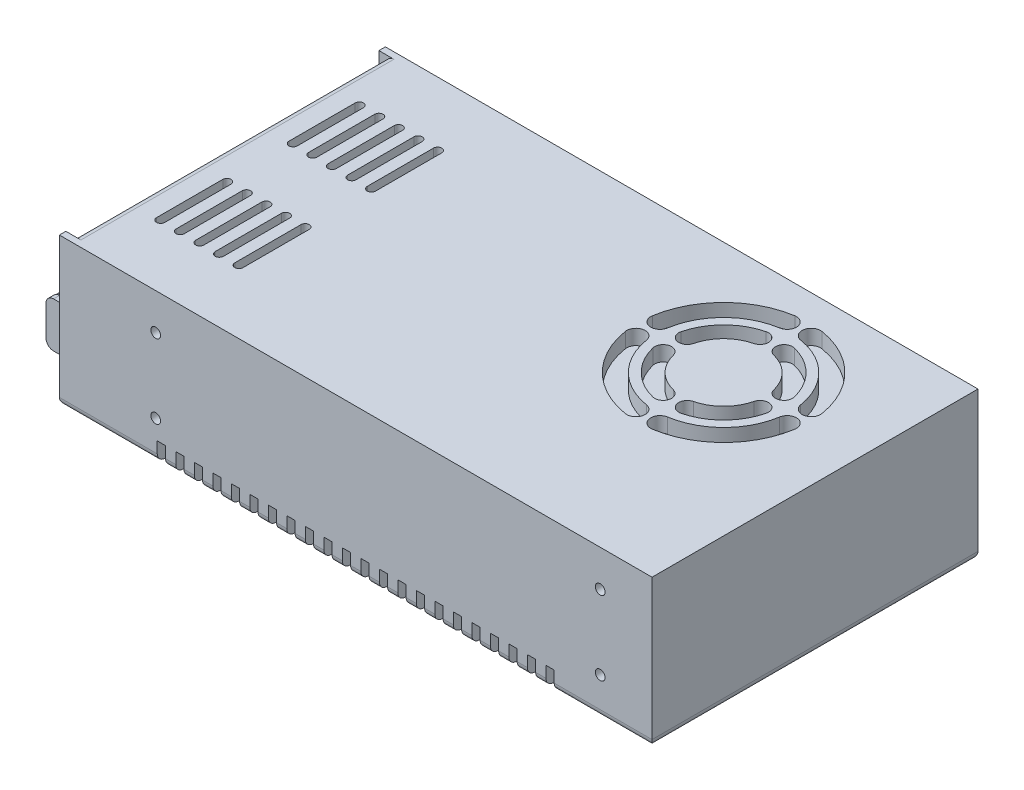
from build123d import *

# Parameters (mm, degrees)
SKETCH1_W                 = 200
SKETCH1_H                 = 110
BOSS_EXTRUDE1_DEPTH       = 50
SKETCH2_W                 = 2.54
SKETCH2_H                 = 105.6312
CUT_EXTRUDE1_DEPTH        = 41.91
SKETCH3_W                 = 89.408
SKETCH3_H                 = 15.24
BOSS_EXTRUDE2_DEPTH       = 12.7
CUT_EXTRUDE3_DEPTH        = 25.4
SKETCH5_W                 = 6.35
SKETCH5_H                 = 8.89
BOSS_EXTRUDE3_DEPTH       = 8.89
SKETCH6_W                 = 8.128
SKETCH6_H                 = 8.128
CUT_EXTRUDE4_DEPTH        = 126.74779117
SKETCH8_R                 = 1.905
BOSS_EXTRUDE4_DEPTH       = 2.54
SKETCH9_R                 = 3.81
BOSS_EXTRUDE5_DEPTH       = 3.81
FILLET1_R                 = 1.27
CUT_EXTRUDE6_DEPTH        = 5.08
CUT_EXTRUDE7_DEPTH        = 5.08
FILLET2_R                 = 2.54
CUT_EXTRUDE8_DEPTH        = 6.35
SKETCH13_W                = 89.408
SKETCH13_H                = 15.24
BOSS_EXTRUDE6_DEPTH       = 0.254
FILLET3_R                 = 2.54
SKETCH14_W                = 1.831730769
SKETCH14_H                = 0.488461538
SKETCH14_W_2              = 3.175
SKETCH14_H_2              = 0.427403847
SKETCH14_W_3              = 0.314102564
SKETCH14_H_3              = 4.532051282
CUT_EXTRUDE9_DEPTH        = 0.254
M4X0_7_TAPPED_HOLE1_D     = 3.3
M4X0_7_TAPPED_HOLE1_DEPTH = 9.906
M4X0_7_TAPPED_HOLE1_TIP   = 0.991420021
M4X0_7_TAPPED_HOLE2_D     = 3.3
M4X0_7_TAPPED_HOLE2_DEPTH = 9.906
M4X0_7_TAPPED_HOLE2_TIP   = 0.991420021
M4X0_7_TAPPED_HOLE3_D     = 3.3
M4X0_7_TAPPED_HOLE3_DEPTH = 9.906
M4X0_7_TAPPED_HOLE3_TIP   = 0.991420021


with BuildPart() as part:
    # Sketch1 → Boss-Extrude1 (new body)
    with BuildSketch(Plane(origin=(0, 0, 0), x_dir=(1, 0, 0), z_dir=(0, 1, 0))):
        Rectangle(SKETCH1_W, SKETCH1_H)
    extrude(amount=BOSS_EXTRUDE1_DEPTH)

    # Sketch2 → Cut-Extrude1 (cut)
    with BuildSketch(Plane(origin=(0, 50, 0), x_dir=(1, 0, 0), z_dir=(0, 1, 0))):
        with Locations((-98.73, 0)):
            Rectangle(SKETCH2_W, SKETCH2_H)
    extrude(amount=-CUT_EXTRUDE1_DEPTH, mode=Mode.SUBTRACT)

    # Sketch3 → Boss-Extrude2 (add)
    with BuildSketch(Plane.ZY.offset(97.46)):
        with Locations((4.4032, 16.8402)):
            Rectangle(SKETCH3_W, SKETCH3_H)
    extrude(amount=BOSS_EXTRUDE2_DEPTH)

    # Sketch4 → Cut-Extrude3 (cut)
    with BuildSketch(Plane.ZY.offset(97.46)):
        Polygon((-40.3008, 9.2202), (-52.8156, 9.2202), (-52.8156, 27.0002), (52.8156, 27.0002), (52.8156, 9.2202), (49.1072, 9.2202), (49.1072, 24.4602), (-40.3008, 24.4602), align=None)
    extrude(amount=-CUT_EXTRUDE3_DEPTH, mode=Mode.SUBTRACT)

    # Sketch5 → Boss-Extrude3 (add)
    with BuildSketch(Plane(origin=(0, 9.2202, 0), x_dir=(1, 0, 0), z_dir=(0, 1, 0))):
        with Locations((-93.015, 41.2586)):
            Rectangle(SKETCH5_W, SKETCH5_H)
    extrude(amount=BOSS_EXTRUDE3_DEPTH)

    # Sketch6 → Cut-Extrude4 (cut, through all)
    with BuildSketch(Plane(origin=(0, 24.4602, 0), x_dir=(1, 0, 0), z_dir=(0, 1, 0))):
        with Locations((-106.096, 34.2048)):
            Rectangle(SKETCH6_W, SKETCH6_H)
        with Locations((-106.096, 24.5528)):
            Rectangle(SKETCH6_W, SKETCH6_H)
        with Locations((-106.096, 14.9008)):
            Rectangle(SKETCH6_W, SKETCH6_H)
        with Locations((-106.096, 5.2488)):
            Rectangle(SKETCH6_W, SKETCH6_H)
        with Locations((-106.096, -4.4032)):
            Rectangle(SKETCH6_W, SKETCH6_H)
        with Locations((-106.096, -14.0552)):
            Rectangle(SKETCH6_W, SKETCH6_H)
        with Locations((-106.096, -23.7072)):
            Rectangle(SKETCH6_W, SKETCH6_H)
        with Locations((-106.096, -33.3592)):
            Rectangle(SKETCH6_W, SKETCH6_H)
        with Locations((-106.096, -43.0112)):
            Rectangle(SKETCH6_W, SKETCH6_H)
    extrude(amount=-CUT_EXTRUDE4_DEPTH, mode=Mode.SUBTRACT)

    # Sketch8 → Boss-Extrude4 (add)
    with BuildSketch(Plane.ZY.offset(102.032)):
        with Locations(Location((-34.2048, 16.8402, 0), (0, 0, 180))):
            Circle(SKETCH8_R)
        with Locations(Location((-24.5528, 16.8402, 0), (0, 0, 180))):
            Circle(SKETCH8_R)
        with Locations(Location((-14.9008, 16.8402, 0), (0, 0, 180))):
            Circle(SKETCH8_R)
        with Locations(Location((-5.2488, 16.8402, 0), (0, 0, 180))):
            Circle(SKETCH8_R)
        with Locations(Location((4.4032, 16.8402, 0), (0, 0, 180))):
            Circle(SKETCH8_R)
        with Locations(Location((14.0552, 16.8402, 0), (0, 0, 180))):
            Circle(SKETCH8_R)
        with Locations(Location((23.7072, 16.8402, 0), (0, 0, 180))):
            Circle(SKETCH8_R)
        with Locations(Location((33.3592, 16.8402, 0), (0, 0, 180))):
            Circle(SKETCH8_R)
        with Locations(Location((43.0112, 16.8402, 0), (0, 0, 180))):
            Circle(SKETCH8_R)
    extrude(amount=BOSS_EXTRUDE4_DEPTH)

    # Sketch9 → Boss-Extrude5 (add)
    with BuildSketch(Plane.ZY.offset(104.572)):
        with Locations(Location((-34.2048, 16.8402, 0), (0, 0, 180))):
            Circle(SKETCH9_R)
        with Locations(Location((-24.5528, 16.8402, 0), (0, 0, 180))):
            Circle(SKETCH9_R)
        with Locations(Location((-14.9008, 16.8402, 0), (0, 0, 180))):
            Circle(SKETCH9_R)
        with Locations(Location((-5.2488, 16.8402, 0), (0, 0, 180))):
            Circle(SKETCH9_R)
        with Locations(Location((4.4032, 16.8402, 0), (0, 0, 180))):
            Circle(SKETCH9_R)
        with Locations(Location((14.0552, 16.8402, 0), (0, 0, 180))):
            Circle(SKETCH9_R)
        with Locations(Location((23.7072, 16.8402, 0), (0, 0, 180))):
            Circle(SKETCH9_R)
        with Locations(Location((33.3592, 16.8402, 0), (0, 0, 180))):
            Circle(SKETCH9_R)
        with Locations(Location((43.0112, 16.8402, 0), (0, 0, 180))):
            Circle(SKETCH9_R)
    extrude(amount=BOSS_EXTRUDE5_DEPTH)

    # Fillet1
    fillet1_edges = [part.edges().sort_by_distance(p)[0] for p in [
        (-108.382, 16.8402, -30.3948),
        (-108.382, 16.8402, -20.7428),
        (-108.382, 16.8402, -11.0908),
        (-108.382, 16.8402, -1.4388),
        (-108.382, 16.8402, 8.2132),
        (-108.382, 16.8402, 17.8652),
        (-108.382, 16.8402, 27.5172),
        (-108.382, 16.8402, 37.1692),
        (-108.382, 16.8402, 46.8212),
    ]]
    fillet(fillet1_edges, radius=FILLET1_R)

    # Sketch10 → Cut-Extrude6 (cut)
    with BuildSketch(Plane(origin=(0, 50, 0), x_dir=(1, 0, 0), z_dir=(0, 1, 0))):
        with BuildLine():
            ThreePointArc((65.804466646, 20.273886792), (62.126281733, 26.778281733), (55.621886792, 30.456466646))
            ThreePointArc((55.621886792, 30.456466646), (53.539086368, 33.919493485), (57.002113208, 36.00229391))
            ThreePointArc((57.002113208, 36.00229391), (66.167396988, 30.819396988), (71.35029391, 21.654113208))
            ThreePointArc((71.35029391, 21.654113208), (69.267493485, 18.191086368), (65.804466646, 20.273886792))
        make_face()
        with BuildLine():
            ThreePointArc((74.698181493, 20.474722359), (68.322658457, 32.974658457), (55.822722359, 39.350181493))
            ThreePointArc((55.822722359, 39.350181493), (53.239209796, 42.912249338), (56.801277641, 45.495761901))
            ThreePointArc((56.801277641, 45.495761901), (72.722983956, 37.374983956), (80.843761901, 21.453277641))
            ThreePointArc((80.843761901, 21.453277641), (78.260249338, 17.891209796), (74.698181493, 20.474722359))
        make_face()
        with BuildLine():
            ThreePointArc((65.804466646, 13.526113208), (69.267493485, 15.608913632), (71.35029391, 12.145886792))
            ThreePointArc((71.35029391, 12.145886792), (66.167396988, 2.980603012), (57.002113208, -2.20229391))
            ThreePointArc((57.002113208, -2.20229391), (53.539086368, -0.119493485), (55.621886792, 3.343533354))
            ThreePointArc((55.621886792, 3.343533354), (62.126281733, 7.021718267), (65.804466646, 13.526113208))
        make_face()
        with BuildLine():
            ThreePointArc((56.801277641, -11.695761901), (53.239209796, -9.112249338), (55.822722359, -5.550181493))
            ThreePointArc((55.822722359, -5.550181493), (68.322658457, 0.825341543), (74.698181493, 13.325277641))
            ThreePointArc((74.698181493, 13.325277641), (78.260249338, 15.908790204), (80.843761901, 12.346722359))
            ThreePointArc((80.843761901, 12.346722359), (72.722983956, -3.574983956), (56.801277641, -11.695761901))
        make_face()
        with BuildLine():
            ThreePointArc((38.691533354, 13.526113208), (42.369718267, 7.021718267), (48.874113208, 3.343533354))
            ThreePointArc((48.874113208, 3.343533354), (50.956913632, -0.119493485), (47.493886792, -2.20229391))
            ThreePointArc((47.493886792, -2.20229391), (38.328603012, 2.980603012), (33.14570609, 12.145886792))
            ThreePointArc((33.14570609, 12.145886792), (35.228506515, 15.608913632), (38.691533354, 13.526113208))
        make_face()
        with BuildLine():
            ThreePointArc((29.797818507, 13.325277641), (36.173341543, 0.825341543), (48.673277641, -5.550181493))
            ThreePointArc((48.673277641, -5.550181493), (51.256790204, -9.112249338), (47.694722359, -11.695761901))
            ThreePointArc((47.694722359, -11.695761901), (31.773016044, -3.574983956), (23.652238099, 12.346722359))
            ThreePointArc((23.652238099, 12.346722359), (26.235750662, 15.908790204), (29.797818507, 13.325277641))
        make_face()
        with BuildLine():
            ThreePointArc((38.691533354, 20.273886792), (35.228506515, 18.191086368), (33.14570609, 21.654113208))
            ThreePointArc((33.14570609, 21.654113208), (38.328603012, 30.819396988), (47.493886792, 36.00229391))
            ThreePointArc((47.493886792, 36.00229391), (50.956913632, 33.919493485), (48.874113208, 30.456466646))
            ThreePointArc((48.874113208, 30.456466646), (42.369718267, 26.778281733), (38.691533354, 20.273886792))
        make_face()
        with BuildLine():
            ThreePointArc((47.694722359, 45.495761901), (51.256790204, 42.912249338), (48.673277641, 39.350181493))
            ThreePointArc((48.673277641, 39.350181493), (36.173341543, 32.974658457), (29.797818507, 20.474722359))
            ThreePointArc((29.797818507, 20.474722359), (26.235750662, 17.891209796), (23.652238099, 21.453277641))
            ThreePointArc((23.652238099, 21.453277641), (31.773016044, 37.374983956), (47.694722359, 45.495761901))
        make_face()
    extrude(amount=-CUT_EXTRUDE6_DEPTH, mode=Mode.SUBTRACT)

    # Sketch11 → Cut-Extrude7 (cut)
    with BuildSketch(Plane(origin=(0, 50, 0), x_dir=(1, 0, 0), z_dir=(0, 1, 0))):
        with BuildLine():
            Line((-85.903, 33.528), (-85.903, 11.176))
            ThreePointArc((-85.903, 11.176), (-87.3, 9.779), (-88.697, 11.176))
            Line((-88.697, 11.176), (-88.697, 33.528))
            ThreePointArc((-88.697, 33.528), (-87.3, 34.925), (-85.903, 33.528))
        make_face()
        with BuildLine():
            Line((-85.903, -11.176), (-85.903, -33.528))
            ThreePointArc((-85.903, -33.528), (-87.3, -34.925), (-88.697, -33.528))
            Line((-88.697, -33.528), (-88.697, -11.176))
            ThreePointArc((-88.697, -11.176), (-87.3, -9.779), (-85.903, -11.176))
        make_face()
        with BuildLine():
            Line((-79.299, 33.528), (-79.299, 11.176))
            ThreePointArc((-79.299, 11.176), (-80.696, 9.779), (-82.093, 11.176))
            Line((-82.093, 11.176), (-82.093, 33.528))
            ThreePointArc((-82.093, 33.528), (-80.696, 34.925), (-79.299, 33.528))
        make_face()
        with BuildLine():
            Line((-79.299, -11.176), (-79.299, -33.528))
            ThreePointArc((-79.299, -33.528), (-80.696, -34.925), (-82.093, -33.528))
            Line((-82.093, -33.528), (-82.093, -11.176))
            ThreePointArc((-82.093, -11.176), (-80.696, -9.779), (-79.299, -11.176))
        make_face()
        with BuildLine():
            Line((-72.695, 33.528), (-72.695, 11.176))
            ThreePointArc((-72.695, 11.176), (-74.092, 9.779), (-75.489, 11.176))
            Line((-75.489, 11.176), (-75.489, 33.528))
            ThreePointArc((-75.489, 33.528), (-74.092, 34.925), (-72.695, 33.528))
        make_face()
        with BuildLine():
            Line((-72.695, -11.176), (-72.695, -33.528))
            ThreePointArc((-72.695, -33.528), (-74.092, -34.925), (-75.489, -33.528))
            Line((-75.489, -33.528), (-75.489, -11.176))
            ThreePointArc((-75.489, -11.176), (-74.092, -9.779), (-72.695, -11.176))
        make_face()
        with BuildLine():
            Line((-66.091, 33.528), (-66.091, 11.176))
            ThreePointArc((-66.091, 11.176), (-67.488, 9.779), (-68.885, 11.176))
            Line((-68.885, 11.176), (-68.885, 33.528))
            ThreePointArc((-68.885, 33.528), (-67.488, 34.925), (-66.091, 33.528))
        make_face()
        with BuildLine():
            Line((-66.091, -11.176), (-66.091, -33.528))
            ThreePointArc((-66.091, -33.528), (-67.488, -34.925), (-68.885, -33.528))
            Line((-68.885, -33.528), (-68.885, -11.176))
            ThreePointArc((-68.885, -11.176), (-67.488, -9.779), (-66.091, -11.176))
        make_face()
        with BuildLine():
            Line((-59.487, 33.528), (-59.487, 11.176))
            ThreePointArc((-59.487, 11.176), (-60.884, 9.779), (-62.281, 11.176))
            Line((-62.281, 11.176), (-62.281, 33.528))
            ThreePointArc((-62.281, 33.528), (-60.884, 34.925), (-59.487, 33.528))
        make_face()
        with BuildLine():
            Line((-59.487, -11.176), (-59.487, -33.528))
            ThreePointArc((-59.487, -33.528), (-60.884, -34.925), (-62.281, -33.528))
            Line((-62.281, -33.528), (-62.281, -11.176))
            ThreePointArc((-62.281, -11.176), (-60.884, -9.779), (-59.487, -11.176))
        make_face()
    extrude(amount=-CUT_EXTRUDE7_DEPTH, mode=Mode.SUBTRACT)

    # Fillet2
    fillet2_edges = [part.edges().sort_by_distance(p)[0] for p in [
        (-97.46, 50, 0),
        (0, 0, 55),
        (-100, 0, 0),
        (0, 0, -55),
        (100, 0, 0),
    ]]
    fillet(fillet2_edges, radius=FILLET2_R)

    # Sketch12 → Cut-Extrude8 (cut)
    with BuildSketch(Plane.XZ):
        with BuildLine():
            Line((64.186, 37.982), (64.186, 55))
            ThreePointArc((64.186, 55), (65.583, 56.397), (66.98, 55))
            Line((66.98, 55), (66.98, 37.982))
            ThreePointArc((66.98, 37.982), (65.583, 36.585), (64.186, 37.982))
        make_face()
        with BuildLine():
            Line((57.94, 37.982), (57.94, 55))
            ThreePointArc((57.94, 55), (59.337, 56.397), (60.734, 55))
            Line((60.734, 55), (60.734, 37.982))
            ThreePointArc((60.734, 37.982), (59.337, 36.585), (57.94, 37.982))
        make_face()
        with BuildLine():
            Line((51.694, 37.982), (51.694, 55))
            ThreePointArc((51.694, 55), (53.091, 56.397), (54.488, 55))
            Line((54.488, 55), (54.488, 37.982))
            ThreePointArc((54.488, 37.982), (53.091, 36.585), (51.694, 37.982))
        make_face()
        with BuildLine():
            Line((45.448, 37.982), (45.448, 55))
            ThreePointArc((45.448, 55), (46.845, 56.397), (48.242, 55))
            Line((48.242, 55), (48.242, 37.982))
            ThreePointArc((48.242, 37.982), (46.845, 36.585), (45.448, 37.982))
        make_face()
        with BuildLine():
            Line((39.202, 37.982), (39.202, 55))
            ThreePointArc((39.202, 55), (40.599, 56.397), (41.996, 55))
            Line((41.996, 55), (41.996, 37.982))
            ThreePointArc((41.996, 37.982), (40.599, 36.585), (39.202, 37.982))
        make_face()
        with BuildLine():
            Line((32.956, 37.982), (32.956, 55))
            ThreePointArc((32.956, 55), (34.353, 56.397), (35.75, 55))
            Line((35.75, 55), (35.75, 37.982))
            ThreePointArc((35.75, 37.982), (34.353, 36.585), (32.956, 37.982))
        make_face()
        with BuildLine():
            Line((26.71, 37.982), (26.71, 55))
            ThreePointArc((26.71, 55), (28.107, 56.397), (29.504, 55))
            Line((29.504, 55), (29.504, 37.982))
            ThreePointArc((29.504, 37.982), (28.107, 36.585), (26.71, 37.982))
        make_face()
        with BuildLine():
            Line((20.464, 37.982), (20.464, 55))
            ThreePointArc((20.464, 55), (21.861, 56.397), (23.258, 55))
            Line((23.258, 55), (23.258, 37.982))
            ThreePointArc((23.258, 37.982), (21.861, 36.585), (20.464, 37.982))
        make_face()
        with BuildLine():
            Line((14.218, 37.982), (14.218, 55))
            ThreePointArc((14.218, 55), (15.615, 56.397), (17.012, 55))
            Line((17.012, 55), (17.012, 37.982))
            ThreePointArc((17.012, 37.982), (15.615, 36.585), (14.218, 37.982))
        make_face()
        with BuildLine():
            Line((7.972, 37.982), (7.972, 55))
            ThreePointArc((7.972, 55), (9.369, 56.397), (10.766, 55))
            Line((10.766, 55), (10.766, 37.982))
            ThreePointArc((10.766, 37.982), (9.369, 36.585), (7.972, 37.982))
        make_face()
        with BuildLine():
            Line((1.726, 37.982), (1.726, 55))
            ThreePointArc((1.726, 55), (3.123, 56.397), (4.52, 55))
            Line((4.52, 55), (4.52, 37.982))
            ThreePointArc((4.52, 37.982), (3.123, 36.585), (1.726, 37.982))
        make_face()
        with BuildLine():
            Line((-4.52, 37.982), (-4.52, 55))
            ThreePointArc((-4.52, 55), (-3.123, 56.397), (-1.726, 55))
            Line((-1.726, 55), (-1.726, 37.982))
            ThreePointArc((-1.726, 37.982), (-3.123, 36.585), (-4.52, 37.982))
        make_face()
        with BuildLine():
            Line((-10.766, 37.982), (-10.766, 55))
            ThreePointArc((-10.766, 55), (-9.369, 56.397), (-7.972, 55))
            Line((-7.972, 55), (-7.972, 37.982))
            ThreePointArc((-7.972, 37.982), (-9.369, 36.585), (-10.766, 37.982))
        make_face()
        with BuildLine():
            Line((-17.012, 37.982), (-17.012, 55))
            ThreePointArc((-17.012, 55), (-15.615, 56.397), (-14.218, 55))
            Line((-14.218, 55), (-14.218, 37.982))
            ThreePointArc((-14.218, 37.982), (-15.615, 36.585), (-17.012, 37.982))
        make_face()
        with BuildLine():
            Line((-23.258, 37.982), (-23.258, 55))
            ThreePointArc((-23.258, 55), (-21.861, 56.397), (-20.464, 55))
            Line((-20.464, 55), (-20.464, 37.982))
            ThreePointArc((-20.464, 37.982), (-21.861, 36.585), (-23.258, 37.982))
        make_face()
        with BuildLine():
            Line((-29.504, 37.982), (-29.504, 55))
            ThreePointArc((-29.504, 55), (-28.107, 56.397), (-26.71, 55))
            Line((-26.71, 55), (-26.71, 37.982))
            ThreePointArc((-26.71, 37.982), (-28.107, 36.585), (-29.504, 37.982))
        make_face()
        with BuildLine():
            Line((-35.75, 37.982), (-35.75, 55))
            ThreePointArc((-35.75, 55), (-34.353, 56.397), (-32.956, 55))
            Line((-32.956, 55), (-32.956, 37.982))
            ThreePointArc((-32.956, 37.982), (-34.353, 36.585), (-35.75, 37.982))
        make_face()
        with BuildLine():
            Line((-41.996, 37.982), (-41.996, 55))
            ThreePointArc((-41.996, 55), (-40.599, 56.397), (-39.202, 55))
            Line((-39.202, 55), (-39.202, 37.982))
            ThreePointArc((-39.202, 37.982), (-40.599, 36.585), (-41.996, 37.982))
        make_face()
        with BuildLine():
            Line((-48.242, 37.982), (-48.242, 55))
            ThreePointArc((-48.242, 55), (-46.845, 56.397), (-45.448, 55))
            Line((-45.448, 55), (-45.448, 37.982))
            ThreePointArc((-45.448, 37.982), (-46.845, 36.585), (-48.242, 37.982))
        make_face()
        with BuildLine():
            Line((-54.488, 37.982), (-54.488, 55))
            ThreePointArc((-54.488, 55), (-53.091, 56.397), (-51.694, 55))
            Line((-51.694, 55), (-51.694, 37.982))
            ThreePointArc((-51.694, 37.982), (-53.091, 36.585), (-54.488, 37.982))
        make_face()
        with BuildLine():
            Line((-60.734, 37.982), (-60.734, 55))
            ThreePointArc((-60.734, 55), (-59.337, 56.397), (-57.94, 55))
            Line((-57.94, 55), (-57.94, 37.982))
            ThreePointArc((-57.94, 37.982), (-59.337, 36.585), (-60.734, 37.982))
        make_face()
        with BuildLine():
            Line((-66.98, 37.982), (-66.98, 55))
            ThreePointArc((-66.98, 55), (-65.583, 56.397), (-64.186, 55))
            Line((-64.186, 55), (-64.186, 37.982))
            ThreePointArc((-64.186, 37.982), (-65.583, 36.585), (-66.98, 37.982))
        make_face()
    cut_extrude8 = extrude(amount=-CUT_EXTRUDE8_DEPTH, mode=Mode.SUBTRACT)

    # Mirror1: Cut-Extrude8 across plane
    add(cut_extrude8.mirror(Plane.XY), mode=Mode.SUBTRACT)

    # Sketch13 → Boss-Extrude6 (add)
    with BuildSketch(Plane.ZY.offset(110.16)):
        with Locations((4.4032, 16.8402)):
            Rectangle(SKETCH13_W, SKETCH13_H)
    extrude(amount=BOSS_EXTRUDE6_DEPTH)

    # Fillet3
    # the kernel refuses this fillet: 2.54 mm, written as the material it takes off along each edge
    with BuildSketch(Plane(origin=(-110.414, 9.2202, -46.6508), x_dir=(1, 0, 0), z_dir=(0, 0, 1))) as fillet3_piece_1:
        with BuildLine():
            CenterArc((FILLET3_R, FILLET3_R), FILLET3_R, 180, 90)
            Line((0, FILLET3_R), (0, 0))
            Line((0, 0), (FILLET3_R, 0))
        make_face()
    extrude(amount=102.108, mode=Mode.SUBTRACT)
    with BuildSketch(Plane(origin=(-110.414, 24.4602, 55.4572), x_dir=(0, -1, 0), z_dir=(0, 0, -1))) as fillet3_piece_2:
        with BuildLine():
            CenterArc((FILLET3_R, -FILLET3_R), FILLET3_R, 90, 90)
            Line((0, -FILLET3_R), (0, 0))
            Line((0, 0), (FILLET3_R, 0))
        make_face()
    extrude(amount=102.108, mode=Mode.SUBTRACT)

    # Sketch14 → Cut-Extrude9 (cut)
    # profile 1 of 15: a face of its own
    with BuildSketch(Plane.ZY.offset(97.46)):
        Polygon((-48.907907692, 38.1127), (-48.449975, 38.1127), (-46.862475, 34.359559976), (-45.274975, 38.1127), (-44.817042308, 38.1127), (-46.831946154, 33.3502), (-46.893003846, 33.3502), align=None)
    # profile 2 of 15: a face of its own
    with BuildSketch(Plane.ZY.offset(97.46)):
        Polygon((-24.484830769, 35.914623077), (-24.484830769, 37.31895), (-24.057426923, 37.31895), (-24.057426923, 35.914623077), (-22.6531, 35.914623077), (-22.6531, 35.487219231), (-24.057426923, 35.487219231), (-24.057426923, 34.082892308), (-24.484830769, 34.082892308), (-24.484830769, 35.487219231), (-25.889157692, 35.487219231), (-25.889157692, 35.914623077), align=None)
    # profile 3 of 15: a face of its own
    with BuildSketch(Plane.ZY.offset(97.46)):
        Polygon((-21.981465385, 38.1127), (-21.523532692, 38.1127), (-19.936032692, 34.359559976), (-18.348532692, 38.1127), (-17.8906, 38.1127), (-19.905503846, 33.3502), (-19.966561538, 33.3502), align=None)
    # profile 4 of 15: a face of its own
    with BuildSketch(Plane.ZY.offset(97.46)):
        with Locations((5.433438462, 35.181930769)):
            Rectangle(SKETCH14_W, SKETCH14_H)
    # profile 5 of 15: a face of its own
    with BuildSketch(Plane.ZY.offset(97.46)):
        Polygon((6.776707692, 38.1127), (7.234640385, 38.1127), (8.822140385, 34.359559976), (10.409640385, 38.1127), (10.867573077, 38.1127), (8.852669231, 33.3502), (8.791611538, 33.3502), align=None)
    # profile 6 of 15: a face of its own
    with BuildSketch(Plane.ZY.offset(97.46)):
        with Locations((27.719496154, 36.433613462)):
            Rectangle(SKETCH14_W_2, SKETCH14_H_2)
    # profile 7 of 15: a face of its own
    with BuildSketch(Plane.ZY.offset(97.46)):
        with Locations((27.719496154, 35.029286539)):
            Rectangle(SKETCH14_W_2, SKETCH14_H_2)
    # profile 8 of 15: a face of its own
    with BuildSketch(Plane.ZY.offset(97.46)):
        Polygon((35.840169231, 33.3502), (35.840169231, 38.1127), (35.929847716, 38.1127), (39.076226923, 34.364330108), (39.076226923, 38.1127), (39.503630769, 38.1127), (39.503630769, 33.3502), (39.406320072, 33.3502), (36.267573077, 37.089983654), (36.267573077, 33.3502), align=None)
    # profile 9 of 15: a face of its own
    with BuildSketch(Plane.ZY.offset(97.46)):
        Polygon((44.388246154, 38.1127), (44.81565, 38.1127), (44.81565, 33.838661538), (46.647380769, 33.838661538), (46.647380769, 33.3502), (44.388246154, 33.3502), align=None)
    # profile 10 of 15: a face of its own
    with BuildSketch(Plane.ZY.offset(97.46)):
        with BuildLine():
            Line((-41.777138462, 35.907892308), (-41.777138462, 33.3502))
            Line((-41.777138462, 33.3502), (-42.091241026, 33.3502))
            Line((-42.091241026, 33.3502), (-42.091241026, 33.792607853))
            add(Edge.make_bspline(
                [(-42.091241026, 33.792607853), (-42.126659816, 33.752568259), (-42.195780032, 33.674430488), (-42.31122115, 33.572348315), (-42.433589327, 33.487969993), (-42.562290649, 33.419820078), (-42.697208892, 33.368628021), (-42.838044979, 33.332241862), (-42.98485636, 33.308848027), (-43.085108715, 33.306512005), (-43.1359125, 33.305328205)],
                knots=[0, 0, 0, 0, 1.074387032, 2.096679803, 3.090159297, 4.057316773, 5.018401886, 5.985159533, 6.978961417, 8, 8, 8, 8], degree=3))
            add(Edge.make_bspline(
                [(-43.1359125, 33.305328205), (-43.181080454, 33.306554577), (-43.270153659, 33.308973038), (-43.401182736, 33.327735341), (-43.527274985, 33.357865963), (-43.648549558, 33.399766853), (-43.764221703, 33.455347674), (-43.8752818, 33.521888922), (-43.981154492, 33.601129752), (-44.080226031, 33.691717781), (-44.171458031, 33.790112768), (-44.251519304, 33.895058315), (-44.318272384, 34.006100619), (-44.374092465, 34.121833773), (-44.417088809, 34.243148692), (-44.447062443, 34.36962586), (-44.46580289, 34.501115734), (-44.468220351, 34.590655257), (-44.469446154, 34.636057372)],
                knots=[0, 0, 0, 0, 1.033919861, 2.038935746, 3.024066025, 3.998881131, 4.97069526, 5.957263378, 6.95902576, 7.993208707, 9.027059324, 10.027763471, 11.009749337, 11.988697705, 12.965288445, 13.950418724, 14.960734635, 16, 16, 16, 16], degree=3))
            add(Edge.make_bspline(
                [(-44.469446154, 34.636057372), (-44.468193182, 34.680521075), (-44.465716126, 34.768423419), (-44.447262906, 34.897702117), (-44.416231897, 35.022220377), (-44.372684049, 35.141577321), (-44.316842094, 35.255917371), (-44.248914007, 35.365321396), (-44.168894883, 35.470090793), (-44.076642476, 35.56776202), (-43.976707706, 35.657982634), (-43.869798975, 35.73639168), (-43.758575693, 35.804108529), (-43.641312683, 35.857762005), (-43.519745578, 35.901171109), (-43.392792132, 35.931204078), (-43.260980554, 35.948901399), (-43.171490062, 35.951464163), (-43.126096795, 35.952764103)],
                knots=[0, 0, 0, 0, 1.020392517, 2.01726096, 2.990465484, 3.961182959, 4.928053699, 5.906110375, 6.912531644, 7.948652711, 8.985773172, 9.998621852, 10.987621588, 11.969261332, 12.953316658, 13.946091881, 14.958173133, 16, 16, 16, 16], degree=3))
            add(Edge.make_bspline(
                [(-43.126096795, 35.952764103), (-43.073896936, 35.951326351), (-42.971535476, 35.948506988), (-42.821807467, 35.925044261), (-42.680162989, 35.885405794), (-42.545508637, 35.831488296), (-42.418327951, 35.759839567), (-42.299824966, 35.669459606), (-42.188759483, 35.560918419), (-42.124379191, 35.477547974), (-42.091241026, 35.434635096)],
                knots=[0, 0, 0, 0, 1.038897134, 2.037228247, 3.008116434, 3.962042015, 4.918381754, 5.904844433, 6.921570401, 8, 8, 8, 8], degree=3))
            Line((-42.091241026, 35.434635096), (-42.091241026, 35.907892308))
            Line((-42.091241026, 35.907892308), (-41.777138462, 35.907892308))
        make_face()
        with BuildLine():
            add(Edge.make_bspline(
                [(-43.121890064, 35.638661538), (-43.167804402, 35.637027901), (-43.258432002, 35.63380336), (-43.391476004, 35.608629865), (-43.518789418, 35.56674527), (-43.639735492, 35.509463369), (-43.752403709, 35.437434632), (-43.85309738, 35.350313249), (-43.942640081, 35.250476235), (-44.017948345, 35.138374125), (-44.079338842, 35.018196033), (-44.122505874, 34.892571595), (-44.150975122, 34.763766618), (-44.153883642, 34.676403932), (-44.15534359, 34.632551763)],
                knots=[0, 0, 0, 0, 1.031046209, 2.035121221, 3.029706178, 4.034933723, 5.034054252, 6.02443088, 7.017295772, 8.038157696, 9.050218397, 10.03989886, 11.016116709, 12, 12, 12, 12], degree=3))
            add(Edge.make_bspline(
                [(-44.15534359, 34.632551763), (-44.153478696, 34.588961656), (-44.14975622, 34.5019523), (-44.123005525, 34.372971723), (-44.078125652, 34.247317681), (-44.016883589, 34.126056687), (-43.940196964, 34.013472587), (-43.851308312, 33.911732464), (-43.74935803, 33.824242876), (-43.636430523, 33.751005303), (-43.515822553, 33.691842782), (-43.388988621, 33.650677142), (-43.258312983, 33.624099362), (-43.169460649, 33.620994885), (-43.124694551, 33.619430769)],
                knots=[0, 0, 0, 0, 0.979072187, 1.954306742, 2.945804271, 3.96968567, 4.997920485, 5.998718438, 6.996577872, 8.005894225, 9.015743152, 10.005417472, 10.995077863, 12, 12, 12, 12], degree=3))
            add(Edge.make_bspline(
                [(-43.124694551, 33.619430769), (-43.079248049, 33.621090733), (-42.988859462, 33.624392237), (-42.855420754, 33.649673502), (-42.725925791, 33.6914423), (-42.602138563, 33.749341427), (-42.486822432, 33.821098783), (-42.383324554, 33.905105874), (-42.295808586, 34.002809058), (-42.221615976, 34.110185511), (-42.16344056, 34.227897508), (-42.1210645, 34.353231698), (-42.096010595, 34.486192447), (-42.092852865, 34.577056374), (-42.091241026, 34.623437179)],
                knots=[0, 0, 0, 0, 1.01762866, 2.023962475, 3.030623092, 4.058876274, 5.077231937, 6.066672613, 7.034107872, 8.005628644, 8.981990164, 9.965428785, 10.961468474, 12, 12, 12, 12], degree=3))
            add(Edge.make_bspline(
                [(-42.091241026, 34.623437179), (-42.092200682, 34.65877501), (-42.094089589, 34.728331043), (-42.108520159, 34.830458561), (-42.131475085, 34.928192287), (-42.163821255, 35.021634976), (-42.20631254, 35.110269991), (-42.257560306, 35.194733752), (-42.318465755, 35.274586963), (-42.388048452, 35.348730034), (-42.464213654, 35.416356496), (-42.544808195, 35.476720737), (-42.630786942, 35.52630951), (-42.720703979, 35.567350781), (-42.814715313, 35.600009931), (-42.913585933, 35.621797625), (-43.01626492, 35.636757946), (-43.086310975, 35.638020327), (-43.121890064, 35.638661538)],
                knots=[0, 0, 0, 0, 1.050140795, 2.067009409, 3.05949893, 4.030605086, 5.00011959, 5.97591094, 6.962425594, 7.979863591, 8.993523472, 9.986985069, 10.967611495, 11.937549037, 12.921786183, 13.919465291, 14.943216303, 16, 16, 16, 16], degree=3))
        make_face(mode=Mode.SUBTRACT)
    # profile 11 of 15: a face of its own
    with BuildSketch(Plane.ZY.offset(97.46)):
        with BuildLine():
            Line((-38.456625641, 36.93994359), (-38.456625641, 33.3502))
            Line((-38.456625641, 33.3502), (-38.770728205, 33.3502))
            Line((-38.770728205, 33.3502), (-38.770728205, 33.792607853))
            add(Edge.make_bspline(
                [(-38.770728205, 33.792607853), (-38.806146996, 33.752568259), (-38.875267211, 33.674430488), (-38.990708329, 33.572348315), (-39.113076507, 33.487969993), (-39.241777828, 33.419820078), (-39.376696071, 33.368628021), (-39.517532159, 33.332241862), (-39.66434354, 33.308848027), (-39.764595894, 33.306512005), (-39.815399679, 33.305328205)],
                knots=[0, 0, 0, 0, 1.074387032, 2.096679803, 3.090159297, 4.057316773, 5.018401886, 5.985159533, 6.978961417, 8, 8, 8, 8], degree=3))
            add(Edge.make_bspline(
                [(-39.815399679, 33.305328205), (-39.860567633, 33.306554577), (-39.949640838, 33.308973038), (-40.080669915, 33.327735341), (-40.206762165, 33.357865963), (-40.328036737, 33.399766853), (-40.443708883, 33.455347674), (-40.55476898, 33.521888922), (-40.660641672, 33.601129752), (-40.759713211, 33.691717781), (-40.850945211, 33.790112768), (-40.931006484, 33.895058315), (-40.997759563, 34.006100619), (-41.053579644, 34.121833773), (-41.096575989, 34.243148692), (-41.126549623, 34.36962586), (-41.14529007, 34.501115734), (-41.14770753, 34.590655257), (-41.148933333, 34.636057372)],
                knots=[0, 0, 0, 0, 1.033919861, 2.038935746, 3.024066025, 3.998881131, 4.97069526, 5.957263378, 6.95902576, 7.993208707, 9.027059324, 10.027763471, 11.009749337, 11.988697705, 12.965288445, 13.950418724, 14.960734635, 16, 16, 16, 16], degree=3))
            add(Edge.make_bspline(
                [(-41.148933333, 34.636057372), (-41.147680362, 34.680521075), (-41.145203305, 34.768423419), (-41.126750085, 34.897702117), (-41.095719077, 35.022220377), (-41.052171229, 35.141577321), (-40.996329274, 35.255917371), (-40.928401187, 35.365321396), (-40.848382062, 35.470090793), (-40.756129655, 35.56776202), (-40.656194885, 35.657982634), (-40.549286154, 35.73639168), (-40.438062873, 35.804108529), (-40.320799862, 35.857762005), (-40.199232758, 35.901171109), (-40.072279312, 35.931204078), (-39.940467733, 35.948901399), (-39.850977241, 35.951464163), (-39.805583974, 35.952764103)],
                knots=[0, 0, 0, 0, 1.020392517, 2.01726096, 2.990465484, 3.961182959, 4.928053699, 5.906110375, 6.912531644, 7.948652711, 8.985773172, 9.998621852, 10.987621588, 11.969261332, 12.953316658, 13.946091881, 14.958173133, 16, 16, 16, 16], degree=3))
            add(Edge.make_bspline(
                [(-39.805583974, 35.952764103), (-39.753367167, 35.951197007), (-39.650871376, 35.948120971), (-39.500972854, 35.922414604), (-39.359185244, 35.879251726), (-39.224692256, 35.820160445), (-39.098295696, 35.743359694), (-38.979069056, 35.650608246), (-38.869085733, 35.5392811), (-38.80401391, 35.455669526), (-38.770728205, 35.412900321)],
                knots=[0, 0, 0, 0, 1.031072012, 2.023879775, 2.993683497, 3.952812103, 4.918022106, 5.908088563, 6.929940113, 8, 8, 8, 8], degree=3))
            Line((-38.770728205, 35.412900321), (-38.770728205, 36.93994359))
            Line((-38.770728205, 36.93994359), (-38.456625641, 36.93994359))
        make_face()
        with BuildLine():
            add(Edge.make_bspline(
                [(-39.801377244, 35.638661538), (-39.847291581, 35.637027901), (-39.937919181, 35.63380336), (-40.070963183, 35.608629865), (-40.198276598, 35.56674527), (-40.319222672, 35.509463369), (-40.431890888, 35.437434632), (-40.532584559, 35.350313249), (-40.622127261, 35.250476235), (-40.697435525, 35.138374125), (-40.758826022, 35.018196033), (-40.801993054, 34.892571595), (-40.830462301, 34.763766618), (-40.833370822, 34.676403932), (-40.834830769, 34.632551763)],
                knots=[0, 0, 0, 0, 1.031046209, 2.035121221, 3.029706178, 4.034933723, 5.034054252, 6.02443088, 7.017295772, 8.038157696, 9.050218397, 10.03989886, 11.016116709, 12, 12, 12, 12], degree=3))
            add(Edge.make_bspline(
                [(-40.834830769, 34.632551763), (-40.832965876, 34.588961656), (-40.829243399, 34.5019523), (-40.802492705, 34.372971723), (-40.757612831, 34.247317681), (-40.696370768, 34.126056687), (-40.619684144, 34.013472587), (-40.530795491, 33.911732464), (-40.42884521, 33.824242876), (-40.315917703, 33.751005303), (-40.195309732, 33.691842782), (-40.068475801, 33.650677142), (-39.937800163, 33.624099362), (-39.848947829, 33.620994885), (-39.804181731, 33.619430769)],
                knots=[0, 0, 0, 0, 0.979072187, 1.954306742, 2.945804271, 3.96968567, 4.997920485, 5.998718438, 6.996577872, 8.005894225, 9.015743152, 10.005417472, 10.995077863, 12, 12, 12, 12], degree=3))
            add(Edge.make_bspline(
                [(-39.804181731, 33.619430769), (-39.758735228, 33.621090733), (-39.668346641, 33.624392237), (-39.534907934, 33.649673502), (-39.405412971, 33.6914423), (-39.281625742, 33.749341427), (-39.166309611, 33.821098783), (-39.062811734, 33.905105874), (-38.975295765, 34.002809058), (-38.901103156, 34.110185511), (-38.842927739, 34.227897508), (-38.80055168, 34.353231698), (-38.775497774, 34.486192447), (-38.772340044, 34.577056374), (-38.770728205, 34.623437179)],
                knots=[0, 0, 0, 0, 1.01762866, 2.023962475, 3.030623092, 4.058876274, 5.077231937, 6.066672613, 7.034107872, 8.005628644, 8.981990164, 9.965428785, 10.961468474, 12, 12, 12, 12], degree=3))
            add(Edge.make_bspline(
                [(-38.770728205, 34.623437179), (-38.771687861, 34.65877501), (-38.773576769, 34.728331043), (-38.788007338, 34.830458561), (-38.810962265, 34.928192287), (-38.843308435, 35.021634976), (-38.885799719, 35.110269991), (-38.937047485, 35.194733752), (-38.997952935, 35.274586963), (-39.067535631, 35.348730034), (-39.143700834, 35.416356496), (-39.224295374, 35.476720737), (-39.310274121, 35.52630951), (-39.400191158, 35.567350781), (-39.494202493, 35.600009931), (-39.593073112, 35.621797625), (-39.695752099, 35.636757946), (-39.765798155, 35.638020327), (-39.801377244, 35.638661538)],
                knots=[0, 0, 0, 0, 1.050140795, 2.067009409, 3.05949893, 4.030605086, 5.00011959, 5.97591094, 6.962425594, 7.979863591, 8.993523472, 9.986985069, 10.967611495, 11.937549037, 12.921786183, 13.919465291, 14.943216303, 16, 16, 16, 16], degree=3))
        make_face(mode=Mode.SUBTRACT)
    # profile 12 of 15: a face of its own
    with BuildSketch(Plane.ZY.offset(97.46)):
        with BuildLine():
            add(Edge.make_bspline(
                [(-37.626497436, 36.984815385), (-37.606776723, 36.983917905), (-37.568383173, 36.982170633), (-37.513076108, 36.96716046), (-37.463314571, 36.941019679), (-37.418754, 36.907063861), (-37.38137757, 36.865970244), (-37.35424396, 36.819157658), (-37.338192145, 36.767781764), (-37.335966307, 36.732289291), (-37.334830769, 36.714182372)],
                knots=[0, 0, 0, 0, 1.06928763, 2.081757757, 3.080304056, 4.102817284, 5.108909582, 6.075019406, 7.017947647, 8, 8, 8, 8], degree=3))
            add(Edge.make_bspline(
                [(-37.334830769, 36.714182372), (-37.3359884, 36.696545877), (-37.338272203, 36.661752165), (-37.35423201, 36.611259991), (-37.381604212, 36.565103709), (-37.418728977, 36.524089945), (-37.463321139, 36.490153601), (-37.51307435, 36.464007687), (-37.568383644, 36.448998888), (-37.606776882, 36.447251425), (-37.626497436, 36.446353846)],
                knots=[0, 0, 0, 0, 0.962634111, 1.899108286, 2.860048811, 3.872254101, 4.900980094, 5.905593535, 6.924215405, 8, 8, 8, 8], degree=3))
            add(Edge.make_bspline(
                [(-37.626497436, 36.446353846), (-37.646217989, 36.447251425), (-37.684611228, 36.448998888), (-37.739920522, 36.464007687), (-37.789673733, 36.490153601), (-37.834265895, 36.524089945), (-37.871390659, 36.565103709), (-37.898762862, 36.611259991), (-37.914722669, 36.661752165), (-37.917006472, 36.696545877), (-37.918164103, 36.714182372)],
                knots=[0, 0, 0, 0, 1.075784595, 2.094406465, 3.099019906, 4.127745899, 5.139951189, 6.100891714, 7.037365889, 8, 8, 8, 8], degree=3))
            add(Edge.make_bspline(
                [(-37.918164103, 36.714182372), (-37.917028565, 36.732289291), (-37.914802727, 36.767781764), (-37.898750912, 36.819157658), (-37.871617301, 36.865970244), (-37.834240872, 36.907063861), (-37.789680301, 36.941019679), (-37.739918764, 36.96716046), (-37.684611699, 36.982170633), (-37.646218149, 36.983917905), (-37.626497436, 36.984815385)],
                knots=[0, 0, 0, 0, 0.982052353, 1.924980594, 2.891090418, 3.897182716, 4.919695944, 5.918242243, 6.93071237, 8, 8, 8, 8], degree=3))
        make_face()
    # profile 13 of 15: a face of its own
    with BuildSketch(Plane.ZY.offset(97.46)):
        with BuildLine():
            Line((-37.783548718, 35.907892308), (-37.469446154, 35.907892308))
            Line((-37.469446154, 35.907892308), (-37.469446154, 32.976502083))
            add(Edge.make_bspline(
                [(-37.469446154, 32.976502083), (-37.469546412, 32.950545544), (-37.469739068, 32.900667681), (-37.475910965, 32.82864315), (-37.483917243, 32.761865864), (-37.495591708, 32.700413307), (-37.511038423, 32.644335895), (-37.530000609, 32.593992346), (-37.551329847, 32.548317625), (-37.577744772, 32.508978115), (-37.606466479, 32.474452966), (-37.637746093, 32.444579212), (-37.671412305, 32.418980822), (-37.70825606, 32.398883865), (-37.747078604, 32.382214174), (-37.788712093, 32.371471054), (-37.832586394, 32.363918441), (-37.862740765, 32.363324838), (-37.87820016, 32.363020513)],
                knots=[0, 0, 0, 0, 1.493029139, 2.868991889, 4.156754484, 5.362105958, 6.464967428, 7.499106053, 8.455465818, 9.358121702, 10.217355437, 11.035397588, 11.842309395, 12.643033568, 13.444773531, 14.266895717, 15.11148054, 16, 16, 16, 16], degree=3))
            add(Edge.make_bspline(
                [(-37.87820016, 32.363020513), (-37.905382942, 32.363959701), (-37.96156287, 32.365900767), (-38.047839763, 32.382875111), (-38.139162248, 32.407818625), (-38.200435463, 32.431399397), (-38.232266667, 32.443649519)],
                knots=[0, 0, 0, 0, 0.892368802, 1.844300437, 2.88012224, 4, 4, 4, 4], degree=3))
            Line((-38.232266667, 32.443649519), (-38.232266667, 32.745833013))
            add(Edge.make_bspline(
                [(-38.232266667, 32.745833013), (-38.212405613, 32.735240981), (-38.174508558, 32.715030229), (-38.116509461, 32.694571617), (-38.062180793, 32.67958077), (-38.026460315, 32.67792031), (-38.009309936, 32.677123077)],
                knots=[0, 0, 0, 0, 1.144578483, 2.183980519, 3.128079311, 4, 4, 4, 4], degree=3))
            add(Edge.make_bspline(
                [(-38.009309936, 32.677123077), (-37.989481119, 32.678396533), (-37.951240163, 32.680852464), (-37.897917888, 32.702045854), (-37.852967623, 32.738016805), (-37.83222352, 32.77034566), (-37.821409295, 32.787199199)],
                knots=[0, 0, 0, 0, 1.036054724, 1.998088038, 2.956371939, 4, 4, 4, 4], degree=3))
            add(Edge.make_bspline(
                [(-37.821409295, 32.787199199), (-37.81526893, 32.801998267), (-37.800900497, 32.836628034), (-37.791085636, 32.901420582), (-37.784200692, 32.983798671), (-37.783779734, 33.045180414), (-37.783548718, 33.078865865)],
                knots=[0, 0, 0, 0, 0.647276487, 1.514624746, 2.636060416, 4, 4, 4, 4], degree=3))
            Line((-37.783548718, 33.078865865), (-37.783548718, 35.907892308))
        make_face()
    # profile 14 of 15: a face of its own
    with BuildSketch(Plane.ZY.offset(97.46)):
        with Locations((-5.857266667, 34.673917949)):
            Rectangle(SKETCH14_W_3, SKETCH14_H_3)
    # profile 15 of 15: a face of its own
    with BuildSketch(Plane.ZY.offset(97.46)):
        with Locations((21.64914359, 34.673917949)):
            Rectangle(SKETCH14_W_3, SKETCH14_H_3)
    extrude(amount=-CUT_EXTRUDE9_DEPTH, mode=Mode.SUBTRACT)

    # M4x0.7 Tapped Hole1
    with Locations(Plane(origin=(0, 0, -55), x_dir=(-1, 0, 0), z_dir=(0, 0, -1))):
        with Locations((68.25, 12.7), (-68.25, 12.7)):
            Hole(M4X0_7_TAPPED_HOLE1_D / 2, depth=M4X0_7_TAPPED_HOLE1_DEPTH)
            with Locations((0, 0, -(M4X0_7_TAPPED_HOLE1_DEPTH + M4X0_7_TAPPED_HOLE1_TIP / 2))):  # 118° drill point
                Cone(0, M4X0_7_TAPPED_HOLE1_D / 2, M4X0_7_TAPPED_HOLE1_TIP, mode=Mode.SUBTRACT)

    # M4x0.7 Tapped Hole2
    with Locations(Plane.XY.offset(55)):
        with Locations((82.5, 12.7), (82.5, 37.7), (-67.5, 37.7), (-67.5, 12.7)):
            Hole(M4X0_7_TAPPED_HOLE2_D / 2, depth=M4X0_7_TAPPED_HOLE2_DEPTH)
            with Locations((0, 0, -(M4X0_7_TAPPED_HOLE2_DEPTH + M4X0_7_TAPPED_HOLE2_TIP / 2))):  # 118° drill point
                Cone(0, M4X0_7_TAPPED_HOLE2_D / 2, M4X0_7_TAPPED_HOLE2_TIP, mode=Mode.SUBTRACT)

    # M4x0.7 Tapped Hole3
    with Locations(Plane(origin=(0, 0, 0), x_dir=(-1, 0, 0), z_dir=(0, -1, 0))):
        with Locations((-82.5, -27.5), (-82.5, 22.5), (67.5, 22.5), (67.5, -27.5)):
            Hole(M4X0_7_TAPPED_HOLE3_D / 2, depth=M4X0_7_TAPPED_HOLE3_DEPTH)
            with Locations((0, 0, -(M4X0_7_TAPPED_HOLE3_DEPTH + M4X0_7_TAPPED_HOLE3_TIP / 2))):  # 118° drill point
                Cone(0, M4X0_7_TAPPED_HOLE3_D / 2, M4X0_7_TAPPED_HOLE3_TIP, mode=Mode.SUBTRACT)


solid = part.part
